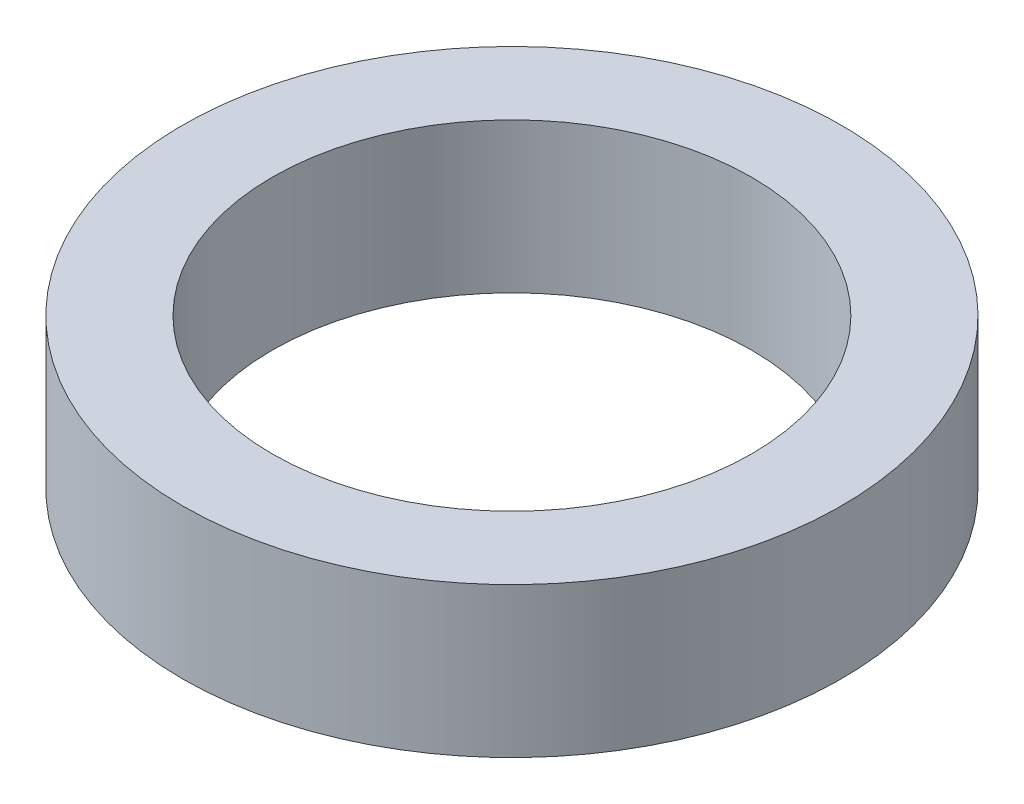
from build123d import *

# Parameters (mm, degrees)
SKETCH1_R           = 11
SKETCH1_R_2         = 8
BOSS_EXTRUDE1_DEPTH = 5


with BuildPart() as part:
    # Sketch1 → Boss-Extrude1 (new body)
    with BuildSketch(Plane(origin=(0, 0, 0), x_dir=(1, 0, 0), z_dir=(0, 1, 0))):
        Circle(SKETCH1_R)
        Circle(SKETCH1_R_2, mode=Mode.SUBTRACT)
    extrude(amount=BOSS_EXTRUDE1_DEPTH)


solid = part.part
